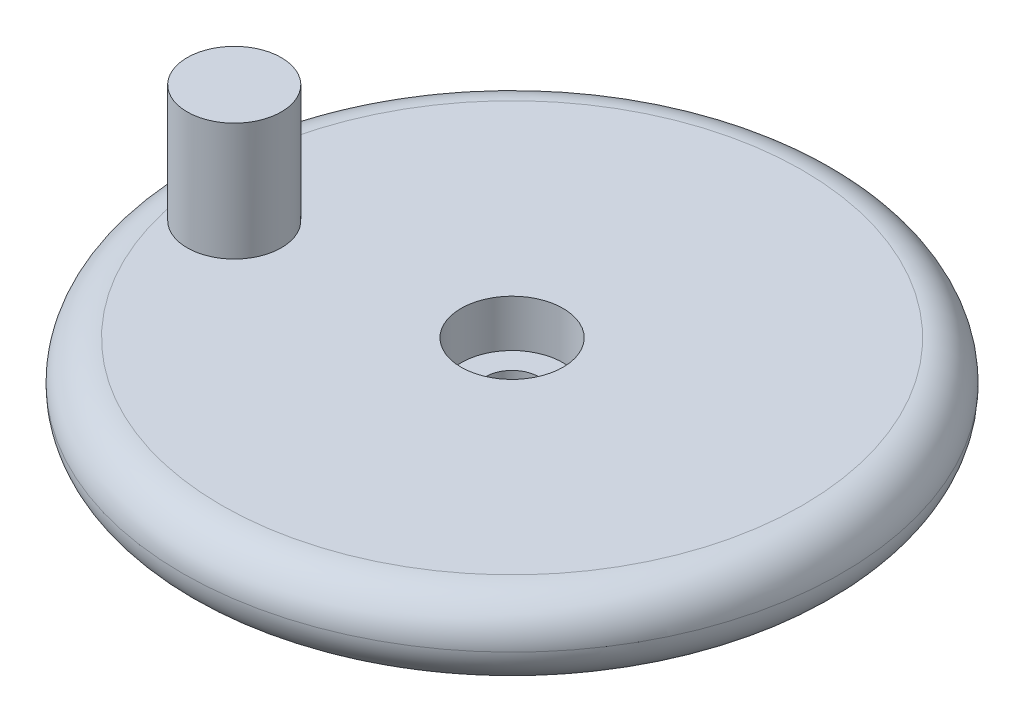
from build123d import *

# Parameters (mm, degrees)
SKETCH1_R                      = 21
BOSS_EXTRUDE1_DEPTH            = 5
FILLET1_R                      = 2.5
SKETCH2_R                      = 3
BOSS_EXTRUDE2_DEPTH            = 7.5
CBORE_FOR_M3_SHCS1_D           = 3.4
CBORE_FOR_M3_SHCS1_CBORE_D     = 6.5
CBORE_FOR_M3_SHCS1_CBORE_DEPTH = 3


with BuildPart() as part:
    # Sketch1 → Boss-Extrude1 (new body)
    with BuildSketch(Plane(origin=(0, 0, 0), x_dir=(1, 0, 0), z_dir=(0, 1, 0))):
        with Locations(Location((0, 0, 0), (0, 0, 270))):
            Circle(SKETCH1_R)
    extrude(amount=BOSS_EXTRUDE1_DEPTH)

    # Fillet1
    fillet1_edges = [part.edges().sort_by_distance(p)[0] for p in [
        (0, 0, -21),
        (0, 5, -21),
    ]]
    fillet(fillet1_edges, radius=FILLET1_R - 0.0001)  # a hair under: the kernel refuses the full size

    # Sketch2 → Boss-Extrude2 (add)
    with BuildSketch(Plane(origin=(0, 5, 0), x_dir=(1, 0, 0), z_dir=(0, 1, 0))):
        with Locations(Location((-15.314964139, -2.387859588, 0), (0, 0, 188.862019992))):
            Circle(SKETCH2_R)
    extrude(amount=BOSS_EXTRUDE2_DEPTH)

    # CBORE for M3 SHCS1 (through all)
    with Locations(Plane(origin=(0, 5, 0), x_dir=(1, 0, 0), z_dir=(0, 1, 0))):
        with Locations((0, 0)):
            CounterBoreHole(CBORE_FOR_M3_SHCS1_D / 2, CBORE_FOR_M3_SHCS1_CBORE_D / 2, CBORE_FOR_M3_SHCS1_CBORE_DEPTH)


solid = part.part
